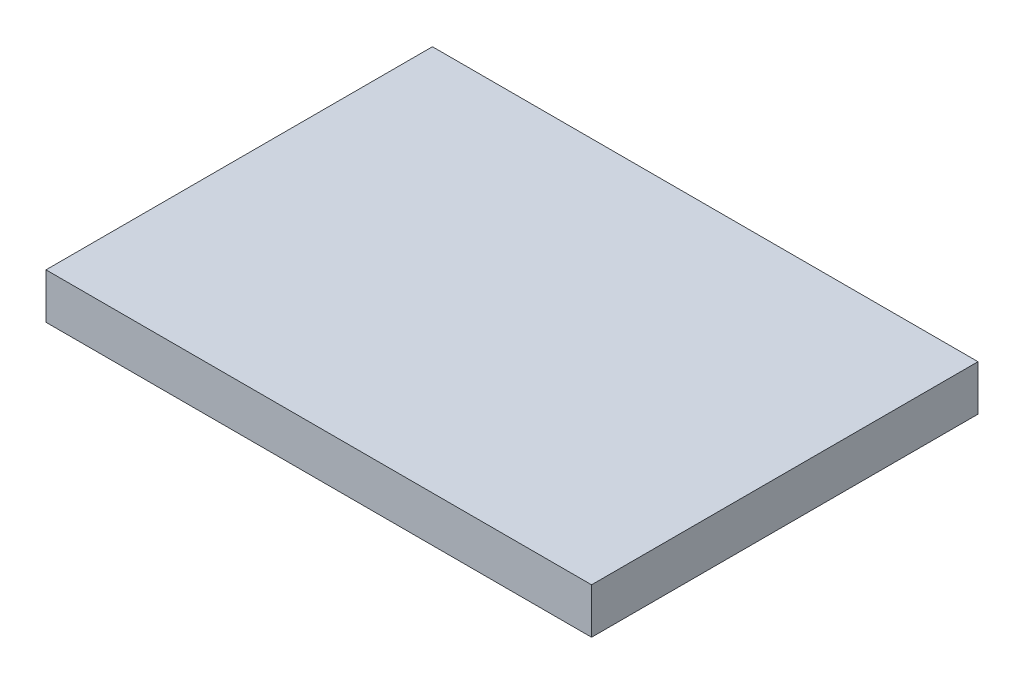
from build123d import *

# Parameters (mm, degrees)
SKETCH1_W           = 24
SKETCH1_H           = 17
BOSS_EXTRUDE1_DEPTH = 2


with BuildPart() as part:
    # Sketch1 → Boss-Extrude1 (new body)
    with BuildSketch(Plane(origin=(0, 0, 0), x_dir=(1, 0, 0), z_dir=(0, 1, 0))):
        Rectangle(SKETCH1_W, SKETCH1_H)
    extrude(amount=BOSS_EXTRUDE1_DEPTH)


solid = part.part
